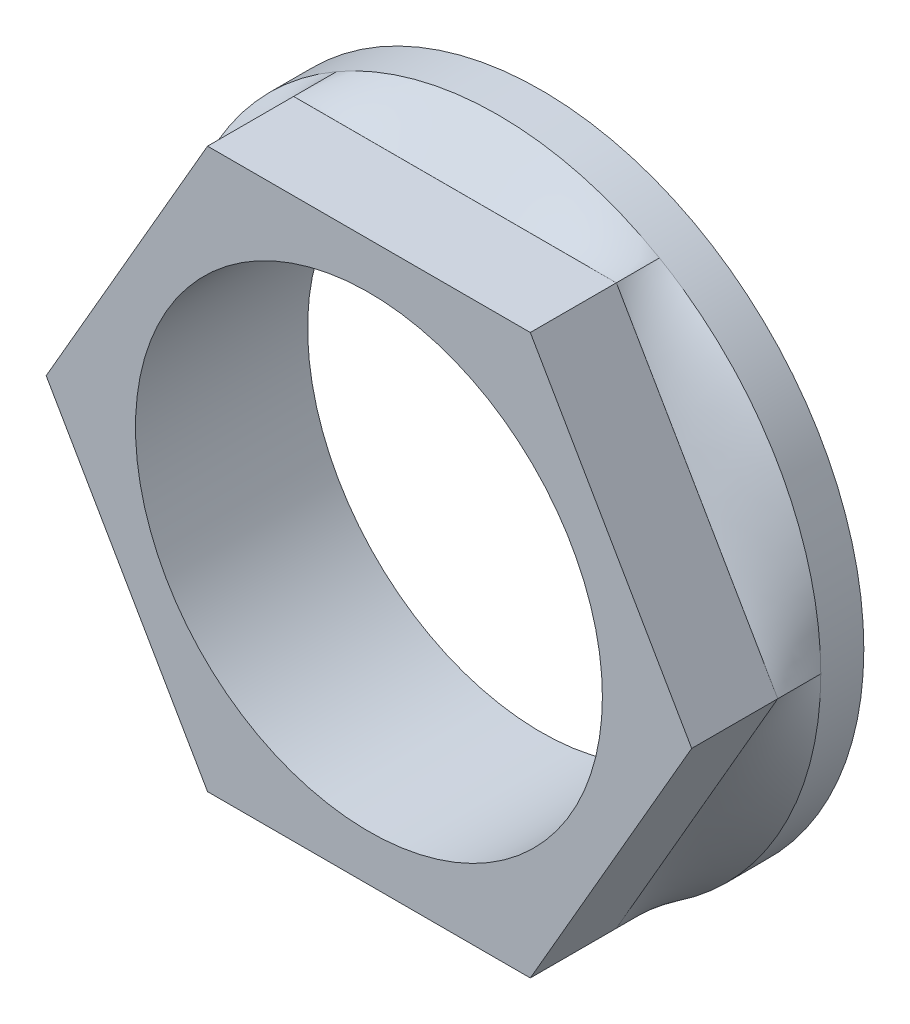
from build123d import *

# Parameters (mm, degrees)
ESQUISSE1_R             = 15
BOSS_EXTRU_1_DEPTH      = 2
BOSS_EXTRU_2_DEPTH      = 4
ENL_V_MAT_EXTRU_1_REACH = 24.672
ESQUISSE4_R             = 10.85


with BuildPart() as part:
    # Esquisse1 → Boss.-Extru.1 (new body)
    with BuildSketch(Plane.XY):
        Circle(ESQUISSE1_R)
    extrude(amount=BOSS_EXTRU_1_DEPTH)

    # Lissage1: read off the stored shape, not the designer's step
    # Lissage1: loft between two sections, ruled curve by curve
    lissage1_from = [
        Edge.make_bspline([(-7.5, 12.990381057, 4), (-6.25, 12.990381057, 4), (-5, 12.990381057, 4), (-2.5, 12.990381057, 4), (-1.25, 12.990381057, 4), (1.25, 12.990381057, 4), (2.5, 12.990381057, 4), (5, 12.990381057, 4), (6.25, 12.990381057, 4), (7.5, 12.990381057, 4)], [0, 0, 0, 0, 0.25, 0.25, 0.5, 0.5, 0.75, 0.75, 1, 1, 1, 1], 3),
        Edge.make_bspline([(7.5, 12.990381057, 4), (8.125, 11.907849302, 4), (8.75, 10.825317547, 4), (10, 8.660254038, 4), (10.625, 7.577722283, 4), (11.875, 5.412658774, 4), (12.5, 4.330127019, 4), (13.75, 2.165063509, 4), (14.375, 1.082531755, 4), (15, 0, 4)], [0, 0, 0, 0, 0.25, 0.25, 0.5, 0.5, 0.75, 0.75, 1, 1, 1, 1], 3),
        Edge.make_bspline([(-15, 0, 4), (-14.375, 1.082531755, 4), (-13.75, 2.165063509, 4), (-12.5, 4.330127019, 4), (-11.875, 5.412658774, 4), (-10.625, 7.577722283, 4), (-10, 8.660254038, 4), (-8.75, 10.825317547, 4), (-8.125, 11.907849302, 4), (-7.5, 12.990381057, 4)], [0, 0, 0, 0, 0.25, 0.25, 0.5, 0.5, 0.75, 0.75, 1, 1, 1, 1], 3),
        Edge.make_bspline([(15, 0, 4), (14.375, -1.082531755, 4), (13.75, -2.165063509, 4), (12.5, -4.330127019, 4), (11.875, -5.412658774, 4), (10.625, -7.577722283, 4), (10, -8.660254038, 4), (8.75, -10.825317547, 4), (8.125, -11.907849302, 4), (7.5, -12.990381057, 4)], [0, 0, 0, 0, 0.25, 0.25, 0.5, 0.5, 0.75, 0.75, 1, 1, 1, 1], 3),
        Edge.make_bspline([(7.5, -12.990381057, 4), (6.25, -12.990381057, 4), (5, -12.990381057, 4), (2.5, -12.990381057, 4), (1.25, -12.990381057, 4), (-1.25, -12.990381057, 4), (-2.5, -12.990381057, 4), (-5, -12.990381057, 4), (-6.25, -12.990381057, 4), (-7.5, -12.990381057, 4)], [0, 0, 0, 0, 0.25, 0.25, 0.5, 0.5, 0.75, 0.75, 1, 1, 1, 1], 3),
        Edge.make_bspline([(-7.5, -12.990381057, 4), (-8.125, -11.907849302, 4), (-8.75, -10.825317547, 4), (-10, -8.660254038, 4), (-10.625, -7.577722283, 4), (-11.875, -5.412658774, 4), (-12.5, -4.330127019, 4), (-13.75, -2.165063509, 4), (-14.375, -1.082531755, 4), (-15, 0, 4)], [0, 0, 0, 0, 0.25, 0.25, 0.5, 0.5, 0.75, 0.75, 1, 1, 1, 1], 3),
    ]
    lissage1_to = [
        Edge.make_bspline([(-7.5, 12.990381057, 2), (-6.417468245, 13.615381057, 2), (-5.218076906, 14.124583256, 2), (-2.678658838, 14.817454761, 2), (-1.339745962, 15, 2), (1.339745962, 15, 2), (2.678658838, 14.817454761, 2), (5.218076906, 14.124583256, 2), (6.417468245, 13.615381057, 2), (7.5, 12.990381057, 2)], [0, 0, 0, 0, 0.25, 0.25, 0.5, 0.5, 0.75, 0.75, 1, 1, 1, 1], 3),
        Edge.make_bspline([(7.5, 12.990381057, 2), (8.582531755, 12.365381057, 2), (9.623209465, 11.581278787, 2), (11.492962823, 9.728513982, 2), (12.320508076, 8.660254038, 2), (13.660254038, 6.339745962, 2), (14.171621661, 5.088940779, 2), (14.841286371, 2.543304469, 2), (15, 1.25, 2), (15, 0, 2)], [0, 0, 0, 0, 0.25, 0.25, 0.5, 0.5, 0.75, 0.75, 1, 1, 1, 1], 3),
        Edge.make_bspline([(-15, 0, 2), (-15, 1.25, 2), (-14.841286371, 2.543304469, 2), (-14.171621661, 5.088940779, 2), (-13.660254038, 6.339745962, 2), (-12.320508076, 8.660254038, 2), (-11.492962823, 9.728513982, 2), (-9.623209465, 11.581278787, 2), (-8.582531755, 12.365381057, 2), (-7.5, 12.990381057, 2)], [0, 0, 0, 0, 0.25, 0.25, 0.5, 0.5, 0.75, 0.75, 1, 1, 1, 1], 3),
        Edge.make_bspline([(15, 0, 2), (15, -1.25, 2), (14.841286371, -2.543304469, 2), (14.171621661, -5.088940779, 2), (13.660254038, -6.339745962, 2), (12.320508076, -8.660254038, 2), (11.492962823, -9.728513982, 2), (9.623209465, -11.581278787, 2), (8.582531755, -12.365381057, 2), (7.5, -12.990381057, 2)], [0, 0, 0, 0, 0.25, 0.25, 0.5, 0.5, 0.75, 0.75, 1, 1, 1, 1], 3),
        Edge.make_bspline([(7.5, -12.990381057, 2), (6.417468245, -13.615381057, 2), (5.218076906, -14.124583256, 2), (2.678658838, -14.817454761, 2), (1.339745962, -15, 2), (-1.339745962, -15, 2), (-2.678658838, -14.817454761, 2), (-5.218076906, -14.124583256, 2), (-6.417468245, -13.615381057, 2), (-7.5, -12.990381057, 2)], [0, 0, 0, 0, 0.25, 0.25, 0.5, 0.5, 0.75, 0.75, 1, 1, 1, 1], 3),
        Edge.make_bspline([(-7.5, -12.990381057, 2), (-8.582531755, -12.365381057, 2), (-9.623209465, -11.581278787, 2), (-11.492962823, -9.728513982, 2), (-12.320508076, -8.660254038, 2), (-13.660254038, -6.339745962, 2), (-14.171621661, -5.088940779, 2), (-14.841286371, -2.543304469, 2), (-15, -1.25, 2), (-15, 0, 2)], [0, 0, 0, 0, 0.25, 0.25, 0.5, 0.5, 0.75, 0.75, 1, 1, 1, 1], 3),
    ]
    lissage1 = Solid(Shell([*[Face.make_surface_from_curves(lissage1_from[k], lissage1_to[k]) for k in range(6)], Face(Wire(lissage1_from)), Face(Wire(lissage1_to))]))
    add(lissage1)

    # Esquisse3 → Boss.-Extru.2 (add)
    with BuildSketch(Plane.XY.offset(4)):
        Polygon((7.5, -12.990381057), (15, 0), (7.5, 12.990381057), (-7.5, 12.990381057), (-15, 0), (-7.5, -12.990381057), align=None)
    extrude(amount=BOSS_EXTRU_2_DEPTH)

    # Esquisse4 → Enlèv. mat.-Extru.1 (cut, up to next)
    with BuildSketch(Plane.XY.offset(8), mode=Mode.PRIVATE) as enl_v_mat_extru_1_sk1:
        Circle(ESQUISSE4_R)
    enl_v_mat_extru_1_tool1 = extrude(enl_v_mat_extru_1_sk1.sketch, amount=-ENL_V_MAT_EXTRU_1_REACH, mode=Mode.PRIVATE) & part.part
    add(enl_v_mat_extru_1_tool1.solids().sort_by_distance((0, 0, 8))[0], mode=Mode.SUBTRACT)


solid = part.part
